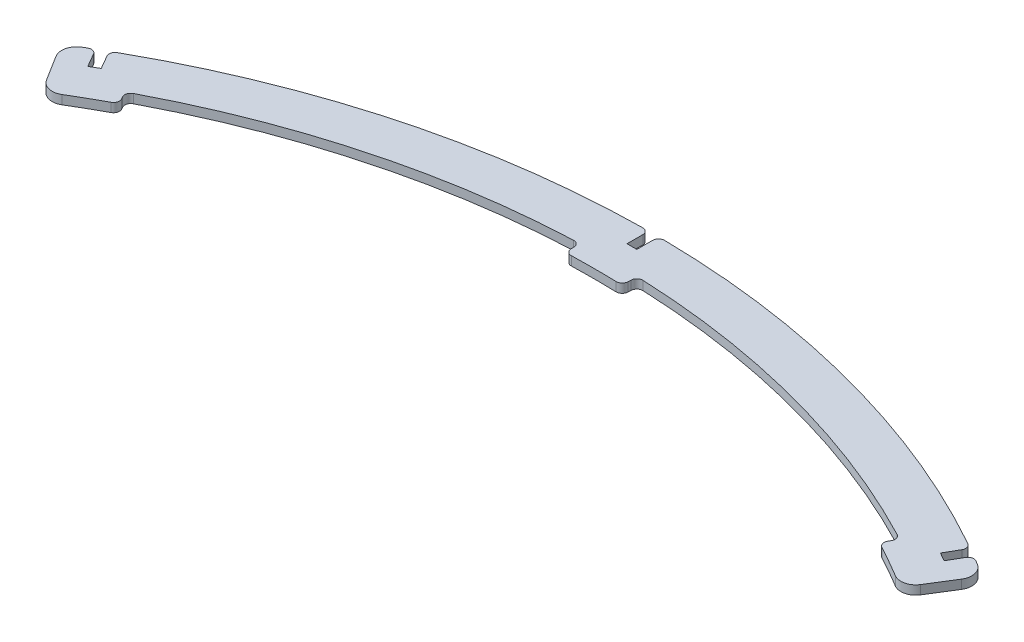
from build123d import *

# Parameters (mm, degrees)
BOSS_EXTRUDE1_DEPTH = 3
FILLET1_R           = 2
FILLET2_R           = 5
FILLET3_R           = 2


with BuildPart() as part:
    # Sketch1 → Boss-Extrude1 (new body)
    with BuildSketch(Plane(origin=(0, 0, 0), x_dir=(1, 0, 0), z_dir=(0, 1, 0))):
        with BuildLine():
            Line((-147.176606992, 251.617360996), (-143.528941916, 245.299419756))
            Line((-143.528941916, 245.299419756), (-140.671058084, 246.949419756))
            Line((-140.671058084, 246.949419756), (-144.318723159, 253.267360996))
            ThreePointArc((-144.318723159, 253.267360996), (-75.445751647, 281.567378363), (-1.65, 291.495330151))
            Line((-1.65, 291.495330151), (-1.65, 284.2))
            Line((-1.65, 284.2), (1.65, 284.2))
            Line((1.65, 284.2), (1.65, 291.495330151))
            ThreePointArc((1.65, 291.495330151), (75.445751647, 281.567378363), (144.318723159, 253.267360996))
            Line((144.318723159, 253.267360996), (140.671058084, 246.949419756))
            Line((140.671058084, 246.949419756), (143.528941916, 245.299419756))
            Line((143.528941916, 245.299419756), (147.176606992, 251.617360996))
            ThreePointArc((147.176606992, 251.617360996), (150.840163403, 249.438359329), (154.471465524, 247.20602003))
            Line((154.471465524, 247.20602003), (143.873080239, 230.245058106))
            ThreePointArc((143.873080239, 230.245058106), (135.75, 235.125897127), (127.461529296, 239.720271461))
            Line((127.461529296, 239.720271461), (129.80888711, 244.135009425))
            ThreePointArc((129.80888711, 244.135009425), (71.563465971, 267.078490969), (9.649710838, 276.331563671))
            Line((9.649710838, 276.331563671), (9.475213355, 271.334609536))
            ThreePointArc((9.475213355, 271.334609536), (0, 271.5), (-9.475213355, 271.334609536))
            Line((-9.475213355, 271.334609536), (-9.649710838, 276.331563671))
            ThreePointArc((-9.649710838, 276.331563671), (-71.563465971, 267.078490969), (-129.80888711, 244.135009425))
            Line((-129.80888711, 244.135009425), (-127.461529296, 239.720271461))
            ThreePointArc((-127.461529296, 239.720271461), (-135.75, 235.125897127), (-143.873080239, 230.245058106))
            Line((-143.873080239, 230.245058106), (-154.471465524, 247.20602003))
            ThreePointArc((-154.471465524, 247.20602003), (-150.840163403, 249.438359329), (-147.176606992, 251.617360996))
        make_face()
    extrude(amount=BOSS_EXTRUDE1_DEPTH)

    # Fillet1
    fillet1_edges = [part.edges().sort_by_distance(p)[0] for p in [
        (127.461529296, 1.5, -239.720271461),
        (129.80888711, 1.5, -244.135009425),
        (-127.461529296, 1.5, -239.720271461),
        (-129.80888711, 1.5, -244.135009425),
        (-9.649710838, 1.5, -276.331563671),
        (-9.475213355, 1.5, -271.334609536),
        (9.475213355, 1.5, -271.334609536),
        (9.649710838, 1.5, -276.331563671),
    ]]
    fillet(fillet1_edges, radius=FILLET1_R)

    # Fillet2
    fillet2_edges = [part.edges().sort_by_distance(p)[0] for p in [
        (-154.471465524, 1.5, -247.20602003),
        (-143.873080239, 1.5, -230.245058106),
        (154.471465524, 1.5, -247.20602003),
        (143.873080239, 1.5, -230.245058106),
    ]]
    fillet(fillet2_edges, radius=FILLET2_R)

    # Fillet3
    fillet3_edges = [part.edges().sort_by_distance(p)[0] for p in [
        (147.176606992, 1.5, -251.617360996),
        (144.318723159, 1.5, -253.267360996),
        (-1.65, 1.5, -291.495330151),
        (1.65, 1.5, -291.495330151),
        (-144.318723159, 1.5, -253.267360996),
        (-147.176606992, 1.5, -251.617360996),
    ]]
    fillet(fillet3_edges, radius=FILLET3_R)


solid = part.part
